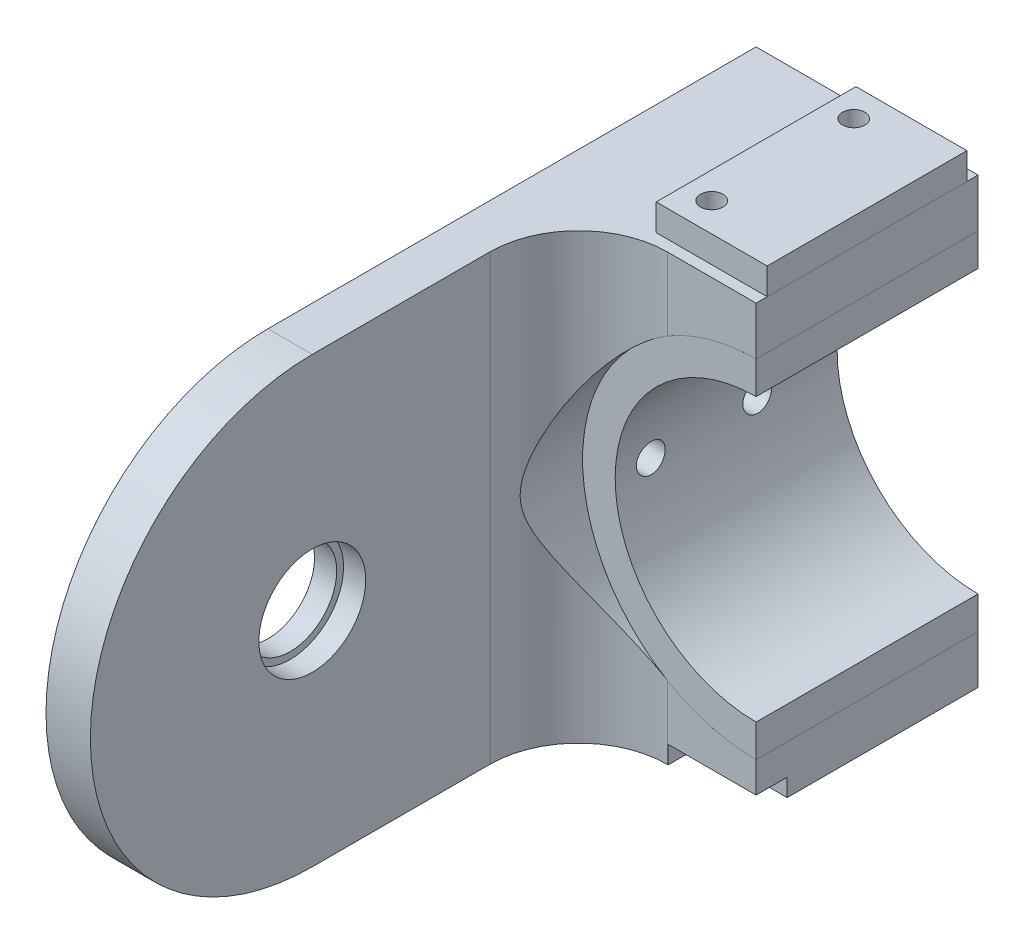
from build123d import *

# Parameters (mm, degrees)
CENTRE_HOLE_FOR_L2_DEPTH      = 40
CENTRE_HOLE_FOR_L2_DEPTH_BACK = 10
SKETCH1_R                     = 39.1
SKETCH1_R_2                   = 31.75
MAIN_STRUCTURE_DEPTH          = 60
MAIN_STRUCTURE_DEPTH_BACK     = 50
SKETCH2_W                     = 100
SKETCH2_H                     = 100
SKETCH2_R                     = 39.1
BEARING_CURVE_DEPTH           = 10
SHAFT_START                   = -10
SHAFT_HOLE_OUTLINE_R          = 10.5
SHAFT_HOLE_DEPTH              = 10
WRIST_CUTOUT_DEPTH            = 188.082869339
SKETCH9_R                     = 12.05
BEARING_DEPTH                 = 5
SURFACECUT1_OUTLINE_R         = 10.5
SURFACECUT1_DEPTH             = 50
SKETCH11_W                    = 25
SKETCH11_H                    = 45
SKETCH11_R                    = 2.525
BOSS_EXTRUDE1_DEPTH           = 6
SKETCH15_W                    = 19.8
SKETCH15_H                    = 7
CUT_EXTRUDE4_DEPTH            = 4
CUT_EXTRUDE5_REACH            = 190.16
CUT_EXTRUDE5_END_RADIUS       = 39.1
SKETCH16_R                    = 1.175
CUT_EXTRUDE6_DEPTH            = 168.7378908
CUT_EXTRUDE6_DEPTH_BACK       = 168.7378908
SKETCH18_R                    = 3.25


# Read off the part's stored shape, not the designer's step: Shaft Hole, SurfaceCut1
with BuildPart() as part:
    # Sketch1 → Centre Hole for L2 (new, two sides: drawn at the far end of the back side and taken through both)
    with BuildSketch(Plane.XY.offset(-CENTRE_HOLE_FOR_L2_DEPTH_BACK)):
        Circle(SKETCH1_R)
        Circle(SKETCH1_R_2, mode=Mode.SUBTRACT)
    extrude(amount=CENTRE_HOLE_FOR_L2_DEPTH + CENTRE_HOLE_FOR_L2_DEPTH_BACK)


with BuildPart() as body_2:
    # Sketch2 → Main Structure (new, two sides: drawn at the far end of the back side and taken through both)
    with BuildSketch(Plane.XY.offset(40).offset(-MAIN_STRUCTURE_DEPTH_BACK)):
        Rectangle(SKETCH2_W, SKETCH2_H)
        Circle(SKETCH2_R, mode=Mode.SUBTRACT)
    extrude(amount=MAIN_STRUCTURE_DEPTH + MAIN_STRUCTURE_DEPTH_BACK)

    # Sketch3 → Bearing Curve (add)
    with BuildSketch(Plane.ZY.offset(50)):
        with BuildLine():
            Line((100, 50), (100, -50))
            ThreePointArc((100, -50), (150, 0), (100, 50))
        make_face()
    bearing_curve = extrude(amount=-BEARING_CURVE_DEPTH)

    # Upright Mirror: Bearing Curve across plane
    add(bearing_curve.mirror(Plane(origin=(0, 0, 0), x_dir=(0, 0, 1), z_dir=(1, 0, 0))))

    # Shaft Hole outline → Shaft Hole (cut)
    with BuildSketch(Plane.ZY.offset(50).offset(SHAFT_START)):
        with Locations((100, 0)):
            Circle(SHAFT_HOLE_OUTLINE_R)
    shaft_hole = extrude(amount=SHAFT_HOLE_DEPTH, mode=Mode.SUBTRACT)

    # Sketch4 → Wrist Cutout (cut, through all)
    with BuildSketch(Plane(origin=(0, 50, 0), x_dir=(1, 0, 0), z_dir=(0, 1, 0))):
        with BuildLine():
            Line((-40, -100), (-40, -60))
            ThreePointArc((-40, -60), (-34.142135624, -45.857864376), (-20, -40))
            Line((-20, -40), (20, -40))
            ThreePointArc((20, -40), (34.142135624, -45.857864376), (40, -60))
            Line((40, -60), (40, -100))
            Line((40, -100), (-40, -100))
        make_face()
    extrude(amount=-WRIST_CUTOUT_DEPTH, mode=Mode.SUBTRACT)

    # Sketch9 → Bearing (cut)
    with BuildSketch(Plane(origin=(-40, 0, 0), x_dir=(0, 0, -1), z_dir=(1, 0, 0))):
        with Locations((-100, 0)):
            Circle(SKETCH9_R)
    bearing = extrude(amount=-BEARING_DEPTH, mode=Mode.SUBTRACT)

    # Bearing Mirror: Shaft Hole, Bearing across plane
    add(shaft_hole.mirror(Plane(origin=(0, 0, 0), x_dir=(0, 0, 1), z_dir=(1, 0, 0))), mode=Mode.SUBTRACT)
    add(bearing.mirror(Plane(origin=(0, 0, 0), x_dir=(0, 0, 1), z_dir=(1, 0, 0))), mode=Mode.SUBTRACT)


with BuildPart() as surfacecut1_tool:
    # SurfaceCut1 outline → SurfaceCut1 (new body)
    with BuildSketch(Plane.YZ):
        with BuildLine():
            ThreePointArc((50, 100), (0, 150), (-50, 100))
            Line((-50, 100), (-50, -10))
            Line((-50, -10), (50, -10))
            Line((50, -10), (50, 100))
        make_face()
        with Locations((0, 100)):
            Circle(SURFACECUT1_OUTLINE_R, mode=Mode.SUBTRACT)
    extrude(amount=SURFACECUT1_DEPTH)


with BuildPart() as part_1:
    add(part.part)

    # SurfaceCut1: cut by surfacecut1_tool
    add(surfacecut1_tool.part, mode=Mode.SUBTRACT)


with BuildPart() as body_2_1:
    add(body_2.part)

    # SurfaceCut1: cut by surfacecut1_tool
    add(surfacecut1_tool.part, mode=Mode.SUBTRACT)

    # Sketch15 → Cut-Extrude4 (cut)
    with BuildSketch(Plane(origin=(0, -50, 0), x_dir=(-1, 0, 0), z_dir=(0, -1, 0))):
        with Locations((9.9, -36.5)):
            Rectangle(SKETCH15_W, SKETCH15_H)
    extrude(amount=-CUT_EXTRUDE4_DEPTH, mode=Mode.SUBTRACT)

    # Cut-Extrude5: up to this cylinder (the profile starts outside it)
    cut_extrude5_end = Plane(origin=(0, 0, 35.9), z_dir=(0, 0, 1)) * Cylinder(CUT_EXTRUDE5_END_RADIUS, 459.52, mode=Mode.PRIVATE)
    # Sketch16 → Cut-Extrude5 (cut, up to the surface)
    with BuildSketch(Plane(origin=(0, -46, 0), x_dir=(-1, 0, 0), z_dir=(0, -1, 0)), mode=Mode.PRIVATE) as cut_extrude5_sk1:
        with Locations(Location((14.65, -35.9, 0), (0, 0, 90))):
            Circle(SKETCH16_R)
    cut_extrude5_tool1 = extrude(cut_extrude5_sk1.sketch, amount=-CUT_EXTRUDE5_REACH, mode=Mode.PRIVATE) - cut_extrude5_end
    add(cut_extrude5_tool1.solids().sort_by_distance((-14.65, -46, 35.9))[0], mode=Mode.SUBTRACT)
    # Sketch16 → Cut-Extrude5 (cut, up to the surface)
    with BuildSketch(Plane(origin=(0, -46, 0), x_dir=(-1, 0, 0), z_dir=(0, -1, 0)), mode=Mode.PRIVATE) as cut_extrude5_sk2:
        with Locations(Location((5.15, -35.9, 0), (0, 0, 90))):
            Circle(SKETCH16_R)
    cut_extrude5_tool2 = extrude(cut_extrude5_sk2.sketch, amount=-CUT_EXTRUDE5_REACH, mode=Mode.PRIVATE) - cut_extrude5_end
    add(cut_extrude5_tool2.solids().sort_by_distance((-5.15, -46, 35.9))[0], mode=Mode.SUBTRACT)


with BuildPart() as body_3:
    # Sketch11 → Boss-Extrude1 (new body)
    with BuildSketch(Plane(origin=(0, 50, 0), x_dir=(1, 0, 0), z_dir=(0, 1, 0))):
        with Locations((-12.5, -15)):
            Rectangle(SKETCH11_W, SKETCH11_H)
        with Locations(Location((-19, 1, 0), (0, 0, 270))):
            Circle(SKETCH11_R, mode=Mode.SUBTRACT)
        with Locations(Location((-19, -31, 0), (0, 0, 270))):
            Circle(SKETCH11_R, mode=Mode.SUBTRACT)
    extrude(amount=BOSS_EXTRUDE1_DEPTH)


with BuildPart() as cut_extrude6_tool:
    # Sketch18 → Cut-Extrude6 (new, two sides: drawn at the far end of the back side and taken through both)
    with BuildSketch(Plane.ZY.offset(50).offset(-CUT_EXTRUDE6_DEPTH_BACK)):
        with Locations((8, 0)):
            Circle(SKETCH18_R)
        with Locations((32, 0)):
            Circle(SKETCH18_R)
    extrude(amount=CUT_EXTRUDE6_DEPTH + CUT_EXTRUDE6_DEPTH_BACK)


with BuildPart() as part_2:
    add(part_1.part)

    # Cut-Extrude6: cut by cut_extrude6_tool
    add(cut_extrude6_tool.part, mode=Mode.SUBTRACT)


with BuildPart() as body_2_2:
    add(body_2_1.part)

    # Cut-Extrude6: cut by cut_extrude6_tool
    add(cut_extrude6_tool.part, mode=Mode.SUBTRACT)


solid = Compound([body_3.part, part_2.part, body_2_2.part])
